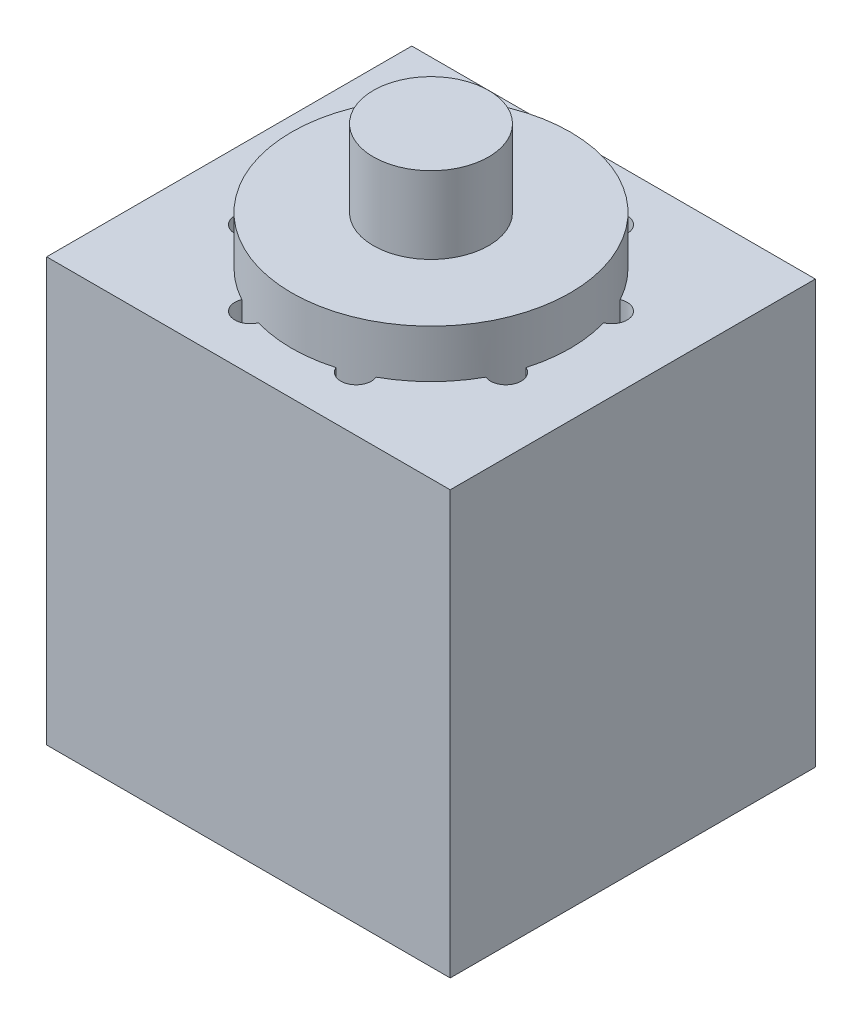
from build123d import *

# Parameters (mm, degrees)
F_01_HOUSING_PROFILE_W        = 210
F_01_HOUSING_PROFILE_H        = 190
F_01_HOUSING_PROFILE_R        = 8
F_01_HOUSING_BLOCK_DEPTH      = 220
F_02_FACE_BOSS_PROFILE_R      = 72.5
F_02_FACE_LOCATING_BOSS_DEPTH = 245
F_03_OUTPUT_SHAFT_PROFILE_R   = 30
F_03_OUTPUT_SHAFT_DEPTH       = 285


with BuildPart() as part:
    # 01_Housing_Profile → 01_Housing_Block (new body)
    with BuildSketch(Plane(origin=(0, 0, 0), x_dir=(1, 0, 0), z_dir=(0, 1, 0))):
        Rectangle(F_01_HOUSING_PROFILE_W, F_01_HOUSING_PROFILE_H)
        with Locations((66.519326341, 27.55320713)):
            Circle(F_01_HOUSING_PROFILE_R, mode=Mode.SUBTRACT)
        with Locations((27.55320713, 66.519326341)):
            Circle(F_01_HOUSING_PROFILE_R, mode=Mode.SUBTRACT)
        with Locations((-27.55320713, 66.519326341)):
            Circle(F_01_HOUSING_PROFILE_R, mode=Mode.SUBTRACT)
        with Locations((-66.519326341, 27.55320713)):
            Circle(F_01_HOUSING_PROFILE_R, mode=Mode.SUBTRACT)
        with Locations((-66.519326341, -27.55320713)):
            Circle(F_01_HOUSING_PROFILE_R, mode=Mode.SUBTRACT)
        with Locations((-27.55320713, -66.519326341)):
            Circle(F_01_HOUSING_PROFILE_R, mode=Mode.SUBTRACT)
        with Locations((27.55320713, -66.519326341)):
            Circle(F_01_HOUSING_PROFILE_R, mode=Mode.SUBTRACT)
        with Locations((66.519326341, -27.55320713)):
            Circle(F_01_HOUSING_PROFILE_R, mode=Mode.SUBTRACT)
    extrude(amount=F_01_HOUSING_BLOCK_DEPTH)

    # 02_Face_Boss_Profile → 02_Face_Locating_Boss (add)
    with BuildSketch(Plane(origin=(0, 0, 0), x_dir=(1, 0, 0), z_dir=(0, 1, 0))):
        Circle(F_02_FACE_BOSS_PROFILE_R)
    extrude(amount=F_02_FACE_LOCATING_BOSS_DEPTH)

    # 03_Output_Shaft_Profile → 03_Output_Shaft (add)
    with BuildSketch(Plane(origin=(0, 0, 0), x_dir=(1, 0, 0), z_dir=(0, 1, 0))):
        Circle(F_03_OUTPUT_SHAFT_PROFILE_R)
    extrude(amount=F_03_OUTPUT_SHAFT_DEPTH)


solid = part.part
